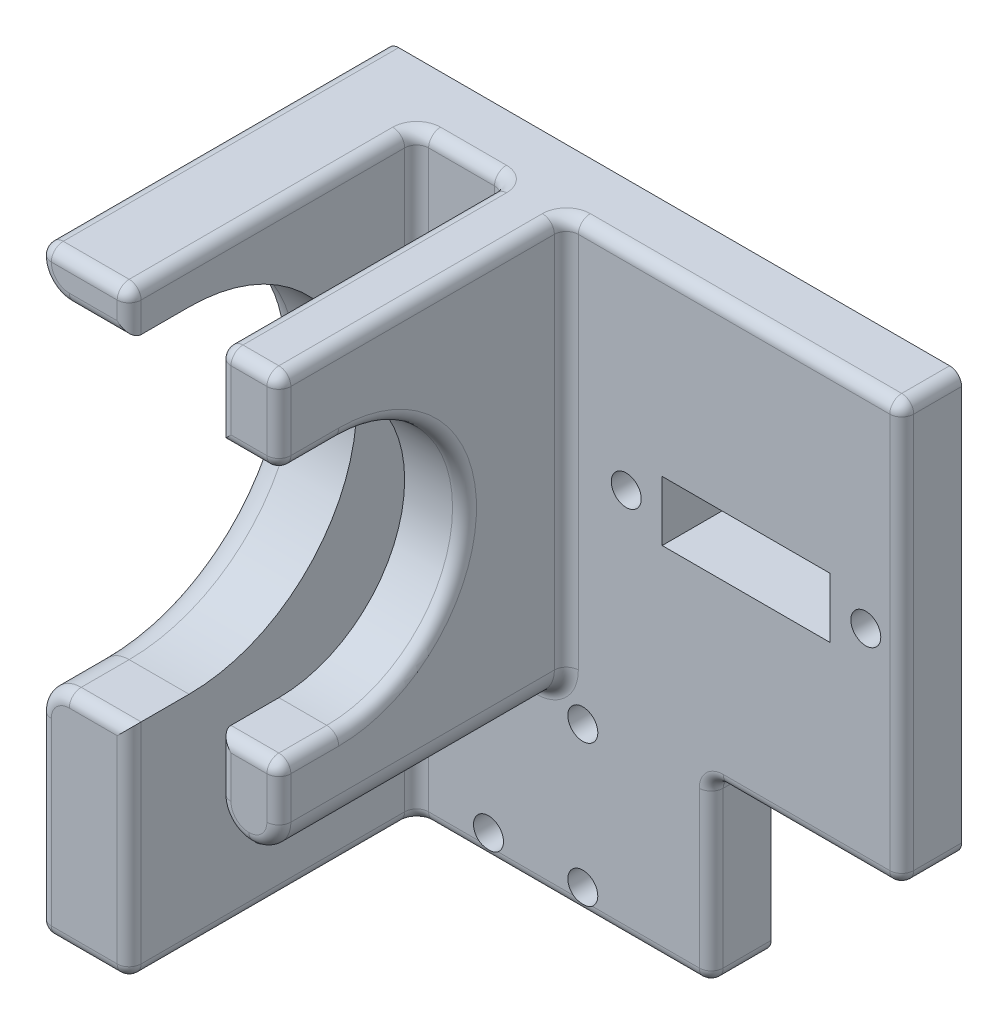
from build123d import *

# Parameters (mm, degrees)
SKETCH1_W           = 60.96
SKETCH1_H           = 44.45
BOSS_EXTRUDE1_DEPTH = 6.35
SKETCH2_W           = 9.525
SKETCH2_H           = 44.45
SKETCH2_W_2         = 6.35
BOSS_EXTRUDE2_DEPTH = 44.45
CUT_EXTRUDE1_DEPTH  = 91.953637091
SKETCH4_R           = 1.5875
CUT_EXTRUDE2_DEPTH  = 44.45
SKETCH6_W           = 17.78
SKETCH6_H           = 6.35
CUT_EXTRUDE3_DEPTH  = 82.369247877
SKETCH7_W           = 9.525
SKETCH7_H           = 36.83
BOSS_EXTRUDE3_DEPTH = 19.05
SKETCH8_R           = 3.048
CUT_EXTRUDE4_DEPTH  = 3.175
SKETCH9_R           = 1.5875
CUT_EXTRUDE5_DEPTH  = 84.954588916
CUT_EXTRUDE6_REACH  = 85.955
SKETCH12_W          = 31.236927456
SKETCH12_H          = 6.35
BOSS_EXTRUDE4_DEPTH = 19.05
FILLET1_R           = 3.175
SKETCH11_R          = 1.5875
CUT_EXTRUDE7_DEPTH  = 84.954588916
FILLET3_R           = 3.175
FILLET4_R           = 1.27


# Some blends are built 0.0001 mm under size
with BuildPart() as part:
    # Sketch1 → Boss-Extrude1 (new body)
    with BuildSketch(Plane.XY):
        with Locations((30.48, 22.225)):
            Rectangle(SKETCH1_W, SKETCH1_H)
    extrude(amount=BOSS_EXTRUDE1_DEPTH)

    # Sketch2 → Boss-Extrude2 (add)
    with BuildSketch(Plane.XY.offset(6.35)):
        with Locations((4.7625, 22.225)):
            Rectangle(SKETCH2_W, SKETCH2_H)
        with Locations((22.225, 22.225)):
            Rectangle(SKETCH2_W_2, SKETCH2_H)
    extrude(amount=BOSS_EXTRUDE2_DEPTH)

    # Sketch3 → Cut-Extrude1 (cut, through all)
    with BuildSketch(Plane.ZY):
        with BuildLine():
            Line((30.48, 35.56), (36.83, 35.56))
            Line((36.83, 35.56), (36.83, 44.45))
            Line((36.83, 44.45), (50.8, 44.45))
            Line((50.8, 44.45), (50.8, 0))
            Line((50.8, 0), (36.83, 0))
            Line((36.83, 0), (36.83, 8.89))
            Line((36.83, 8.89), (30.48, 8.89))
            ThreePointArc((30.48, 8.89), (17.145, 22.225), (30.48, 35.56))
        make_face()
    extrude(amount=-CUT_EXTRUDE1_DEPTH, mode=Mode.SUBTRACT)

    # Sketch4 → Cut-Extrude2 (cut)
    with BuildSketch(Plane.XY.offset(6.35)):
        with Locations((57.15, 22.225)):
            Circle(SKETCH4_R)
        with Locations((31.75, 22.225)):
            Circle(SKETCH4_R)
    extrude(amount=-CUT_EXTRUDE2_DEPTH, mode=Mode.SUBTRACT)

    # Sketch6 → Cut-Extrude3 (cut, through all)
    with BuildSketch(Plane.XY.offset(6.35)):
        with Locations((44.45, 22.225)):
            Rectangle(SKETCH6_W, SKETCH6_H)
    extrude(amount=-CUT_EXTRUDE3_DEPTH, mode=Mode.SUBTRACT)

    # Sketch7 → Boss-Extrude3 (add)
    with BuildSketch(Plane.XZ):
        with Locations((4.7625, 18.415)):
            Rectangle(SKETCH7_W, SKETCH7_H)
    extrude(amount=BOSS_EXTRUDE3_DEPTH)

    # Sketch8 → Cut-Extrude4 (cut)
    with BuildSketch(Plane.ZY):
        with Locations((22.1996, -11.6586)):
            Circle(SKETCH8_R)
    extrude(amount=-CUT_EXTRUDE4_DEPTH, mode=Mode.SUBTRACT)

    # Sketch9 → Cut-Extrude5 (cut, through all)
    with BuildSketch(Plane.ZY):
        with Locations((22.1996, -11.6586)):
            Circle(SKETCH9_R)
    extrude(amount=-CUT_EXTRUDE5_DEPTH, mode=Mode.SUBTRACT)

    # Sketch10 → Cut-Extrude6 (cut, up to next)
    with BuildSketch(Plane.ZY, mode=Mode.PRIVATE) as cut_extrude6_sk1:
        with BuildLine():
            Line((30.48, 4.445), (36.83, 4.445))
            Line((36.83, 4.445), (36.83, 40.005))
            Line((36.83, 40.005), (30.48, 40.005))
            ThreePointArc((30.48, 40.005), (12.7, 22.225), (30.48, 4.445))
        make_face()
    cut_extrude6_tool1 = extrude(cut_extrude6_sk1.sketch, amount=-CUT_EXTRUDE6_REACH, mode=Mode.PRIVATE) & part.part
    add(cut_extrude6_tool1.solids().sort_by_distance((0, 22.225, 26.285194))[0], mode=Mode.SUBTRACT)

    # Sketch12 → Boss-Extrude4 (add)
    with BuildSketch(Plane.XZ):
        with Locations((25.143463728, 3.175)):
            Rectangle(SKETCH12_W, SKETCH12_H)
    extrude(amount=BOSS_EXTRUDE4_DEPTH)

    # Fillet1
    fillet1_edges = [part.edges().sort_by_distance(p)[0] for p in [
        (0, 40.005, 33.655),
        (0, 22.225, 12.7),
        (0, 4.445, 33.655),
    ]]
    fillet(fillet1_edges, radius=FILLET1_R)

    # Sketch11 → Cut-Extrude7 (cut, through all)
    with BuildSketch(Plane(origin=(0, 0, 0), x_dir=(-1, 0, 0), z_dir=(0, 0, -1))):
        with Locations((-27.145, -16.55)):
            Circle(SKETCH11_R)
        with Locations((-17.145, -16.55)):
            Circle(SKETCH11_R)
        with Locations((-17.145, -1.55)):
            Circle(SKETCH11_R)
        with Locations((-27.145, -1.55)):
            Circle(SKETCH11_R)
    extrude(amount=-CUT_EXTRUDE7_DEPTH, mode=Mode.SUBTRACT)

    # Fillet3
    fillet3_edges = [part.edges().sort_by_distance(p)[0] for p in [
        (19.05, 0, 21.59),
        (25.4, 0, 21.59),
    ]]
    fillet(fillet3_edges, radius=FILLET3_R - 0.0001)  # a hair under: the kernel refuses the full size

    # Fillet4
    # the kernel refuses this fillet: 1.27 mm, written as the material it adds along each edge
    with BuildSketch(Plane(origin=(19.05, 44.45, 6.35), x_dir=(-1, 0, 0), z_dir=(0, -1, 0)), Plane(origin=(25.4, 3.1749, 6.35), x_dir=(1, 0, 0), z_dir=(0, 1, 0))) as fillet4_piece_1:
        with BuildLine():
            CenterArc((FILLET4_R, -FILLET4_R), FILLET4_R, 90, 90)
            Line((0, -FILLET4_R), (0, 0))
            Line((0, 0), (FILLET4_R, 0))
        make_face()
    extrude(amount=41.2751)
    with BuildSketch(Plane(origin=(22.2249, 3.1749, 6.35), x_dir=(-1, 0, 0), z_dir=(0, 1, 0))) as fillet4_piece_2:
        with BuildLine():
            CenterArc((3.1749 + FILLET4_R, FILLET4_R), FILLET4_R, 180, 90)
            Line((3.1749, FILLET4_R), (3.1749, 0))
            Line((3.1749, 0), (3.1749 + FILLET4_R, 0))
        make_face()
    revolve(axis=Axis((22.2249, 3.1749, 6.35), (0, 0, 1)), revolution_arc=90)
    with BuildSketch(Plane(origin=(22.2251, 3.1749, 6.35), x_dir=(1, 0, 0), z_dir=(0, 1, 0))) as fillet4_piece_3:
        with BuildLine():
            CenterArc((3.1749 + FILLET4_R, -FILLET4_R), FILLET4_R, 90, 90)
            Line((3.1749, -FILLET4_R), (3.1749, 0))
            Line((3.1749, 0), (3.1749 + FILLET4_R, 0))
        make_face()
    revolve(axis=Axis((22.2251, 3.1749, 6.35), (0, 0, -1)), revolution_arc=90)
    with BuildSketch(Plane(origin=(40.761927456, 0, 6.35), x_dir=(1, 0, 0), z_dir=(0, 0, -1))) as fillet4_piece_4:
        with BuildLine():
            CenterArc((FILLET4_R, FILLET4_R), FILLET4_R, 180, 90)
            Line((0, FILLET4_R), (0, 0))
            Line((0, 0), (FILLET4_R, 0))
        make_face()
    extrude(amount=6.35)
    with BuildSketch(Plane(origin=(9.525, 44.45, 6.35), x_dir=(1, 0, 0), z_dir=(0, -1, 0))) as fillet4_piece_5:
        with BuildLine():
            CenterArc((FILLET4_R, FILLET4_R), FILLET4_R, 180, 90)
            Line((0, FILLET4_R), (0, 0))
            Line((0, 0), (FILLET4_R, 0))
        make_face()
    extrude(amount=63.5)
    with BuildSketch(Plane(origin=(22.2249, 0, 6.35), x_dir=(0, -1, 0), z_dir=(1, 0, 0))) as fillet4_piece_6:
        with BuildLine():
            CenterArc((FILLET4_R, -FILLET4_R), FILLET4_R, 90, 90)
            Line((0, -FILLET4_R), (0, 0))
            Line((0, 0), (FILLET4_R, 0))
        make_face()
    extrude(amount=0.0002)
    # the kernel refuses this fillet: 1.27 mm, written as the material it takes off along each edge
    with BuildSketch(Plane(origin=(24.13, 36.83, 35.56), x_dir=(0, 0, 1), z_dir=(0, -1, 0))) as fillet4_2_piece_1_section:
        Polygon((0, 0), (FILLET4_R, 0), (FILLET4_R, -FILLET4_R), (0, -FILLET4_R), align=None)
    fillet4_2_piece_1 = extrude(amount=FILLET4_R, mode=Mode.PRIVATE)
    fillet4_2_piece_1 = fillet4_2_piece_1 - Plane(origin=(24.13, 36.83, 35.56), x_dir=(-0.7071067811865475, 0, -0.7071067811865475), z_dir=(0, -1, 0)) * Sphere(FILLET4_R, mode=Mode.PRIVATE)
    add(fillet4_2_piece_1, mode=Mode.SUBTRACT)
    with BuildSketch(Plane(origin=(24.13, 7.62, 35.56), x_dir=(0, 0, 1), z_dir=(0, 1, 0))) as fillet4_2_piece_2_section:
        Polygon((0, 0), (FILLET4_R, 0), (FILLET4_R, FILLET4_R), (0, FILLET4_R), align=None)
    fillet4_2_piece_2 = extrude(amount=FILLET4_R, mode=Mode.PRIVATE)
    fillet4_2_piece_2 = fillet4_2_piece_2 - Plane(origin=(24.13, 7.62, 35.56), x_dir=(-0.7071067811865475, 0, -0.7071067811865475), z_dir=(0, 1, 0)) * Sphere(FILLET4_R, mode=Mode.PRIVATE)
    add(fillet4_2_piece_2, mode=Mode.SUBTRACT)
    with BuildSketch(Plane(origin=(1.27, 43.18, 35.56), x_dir=(0, 0, 1), z_dir=(-1, 0, 0))) as fillet4_2_piece_3_section:
        Polygon((0, 0), (FILLET4_R, 0), (FILLET4_R, FILLET4_R), (0, FILLET4_R), align=None)
    fillet4_2_piece_3 = extrude(amount=FILLET4_R, mode=Mode.PRIVATE)
    fillet4_2_piece_3 = fillet4_2_piece_3 - Plane(origin=(1.27, 43.18, 35.56), x_dir=(0, -0.7071067811865479, -0.7071067811865472), z_dir=(-1, 0, 0)) * Sphere(FILLET4_R, mode=Mode.PRIVATE)
    add(fillet4_2_piece_3, mode=Mode.SUBTRACT)
    with BuildSketch(Plane(origin=(1.27, -17.78, 35.56), x_dir=(0, 0, 1), z_dir=(-1, 0, 0))) as fillet4_2_piece_4_section:
        Polygon((0, 0), (FILLET4_R, 0), (FILLET4_R, -FILLET4_R), (0, -FILLET4_R), align=None)
    fillet4_2_piece_4 = extrude(amount=FILLET4_R, mode=Mode.PRIVATE)
    fillet4_2_piece_4 = fillet4_2_piece_4 - Plane(origin=(1.27, -17.78, 35.56), x_dir=(0, 0.7071067811865475, -0.7071067811865475), z_dir=(-1, 0, 0)) * Sphere(FILLET4_R, mode=Mode.PRIVATE)
    add(fillet4_2_piece_4, mode=Mode.SUBTRACT)
    with BuildSketch(Plane(origin=(19.05, 12.065, 36.83), x_dir=(0, 0, -1), z_dir=(0, -1, 0))) as fillet4_2_piece_5:
        with BuildLine():
            CenterArc((FILLET4_R, FILLET4_R), FILLET4_R, 180, 90)
            Line((0, FILLET4_R), (0, 0))
            Line((0, 0), (FILLET4_R, 0))
        make_face()
    extrude(amount=8.8901, mode=Mode.SUBTRACT)
    with BuildSketch(Plane(origin=(22.2249, 3.1749, 36.83), x_dir=(-1, 0, 0), z_dir=(0, 1, 0))) as fillet4_2_piece_6:
        with BuildLine():
            CenterArc((3.1749 - FILLET4_R, -FILLET4_R), FILLET4_R, 0, 90)
            Line((3.1749 - FILLET4_R, 0), (3.1749, 0))
            Line((3.1749, 0), (3.1749, -FILLET4_R))
        make_face()
    revolve(axis=Axis((22.2249, 3.1749, 36.83), (0, 0, 1)), revolution_arc=90, mode=Mode.SUBTRACT)
    with BuildSketch(Plane(origin=(22.2251, 3.1749, 36.83), x_dir=(1, 0, 0), z_dir=(0, 1, 0))) as fillet4_2_piece_7:
        with BuildLine():
            CenterArc((3.1749 - FILLET4_R, FILLET4_R), FILLET4_R, 270, 90)
            Line((3.1749 - FILLET4_R, 0), (3.1749, 0))
            Line((3.1749, 0), (3.1749, FILLET4_R))
        make_face()
    revolve(axis=Axis((22.2251, 3.1749, 36.83), (0, 0, -1)), revolution_arc=90, mode=Mode.SUBTRACT)
    with BuildSketch(Plane(origin=(25.4, 35.56, 30.48), x_dir=(0, 1, 0), z_dir=(0, 0, 1)), Plane(origin=(25.4, 8.89, 35.56), x_dir=(0, -1, 0), z_dir=(0, 0, -1))) as fillet4_2_piece_8:
        with BuildLine():
            CenterArc((FILLET4_R, FILLET4_R), FILLET4_R, 180, 90)
            Line((0, FILLET4_R), (0, 0))
            Line((0, 0), (FILLET4_R, 0))
        make_face()
    extrude(amount=5.08, mode=Mode.SUBTRACT)
    with BuildSketch(Plane(origin=(3.175, 40.005, 36.83), x_dir=(0, 1, 0), z_dir=(1, 0, 0))) as fillet4_2_piece_9:
        with BuildLine():
            CenterArc((FILLET4_R, -FILLET4_R), FILLET4_R, 90, 90)
            Line((0, -FILLET4_R), (0, 0))
            Line((0, 0), (FILLET4_R, 0))
        make_face()
    extrude(amount=9.525, mode=Mode.SUBTRACT)
    with BuildSketch(Plane(origin=(3.175, 43.18, 36.83), x_dir=(-1, 0, 0), z_dir=(0, 1, 0))) as fillet4_2_piece_10:
        with BuildLine():
            CenterArc((3.175 - FILLET4_R, -FILLET4_R), FILLET4_R, 0, 90)
            Line((3.175, -FILLET4_R), (3.175, 0))
            Line((3.175, 0), (3.175 - FILLET4_R, 0))
        make_face()
    revolve(axis=Axis((3.175, 43.18, 36.83), (0, 0, 1)), revolution_arc=90, mode=Mode.SUBTRACT)
    with BuildSketch(Plane(origin=(3.175, 4.445, 36.83), x_dir=(0, -1, 0), z_dir=(1, 0, 0))) as fillet4_2_piece_11:
        with BuildLine():
            CenterArc((FILLET4_R, FILLET4_R), FILLET4_R, 180, 90)
            Line((0, FILLET4_R), (0, 0))
            Line((0, 0), (FILLET4_R, 0))
        make_face()
    extrude(amount=9.525, mode=Mode.SUBTRACT)
    with BuildSketch(Plane(origin=(3.175, 1.27, 36.83), x_dir=(-1, 0, 0), z_dir=(0, -1, 0))) as fillet4_2_piece_12:
        with BuildLine():
            CenterArc((3.175 - FILLET4_R, FILLET4_R), FILLET4_R, 270, 90)
            Line((3.175, FILLET4_R), (3.175, 0))
            Line((3.175, 0), (3.175 - FILLET4_R, 0))
        make_face()
    revolve(axis=Axis((3.175, 1.27, 36.83), (0, 0, -1)), revolution_arc=90, mode=Mode.SUBTRACT)
    with BuildSketch(Plane(origin=(15.875, 8.89, 36.83), x_dir=(0, 0, -1), z_dir=(1, 0, 0)), Plane(origin=(15.875, 35.56, 36.83), x_dir=(0, 1, 0), z_dir=(1, 0, 0))) as fillet4_2_piece_13:
        with BuildLine():
            CenterArc((FILLET4_R, -FILLET4_R), FILLET4_R, 90, 90)
            Line((0, -FILLET4_R), (0, 0))
            Line((0, 0), (FILLET4_R, 0))
        make_face()
    extrude(amount=8.255, mode=Mode.SUBTRACT)
    with BuildSketch(Plane(origin=(40.761927456, -19.05, 9.525), x_dir=(0, 1, 0), z_dir=(0, 0, -1)), Plane(origin=(15.875, 44.45, 36.83), x_dir=(0, 0, -1), z_dir=(1, 0, 0))) as fillet4_2_piece_14:
        with BuildLine():
            CenterArc((FILLET4_R, -FILLET4_R), FILLET4_R, 90, 90)
            Line((0, -FILLET4_R), (0, 0))
            Line((0, 0), (FILLET4_R, 0))
        make_face()
    extrude(amount=12.7, mode=Mode.SUBTRACT)
    with BuildSketch(Plane(origin=(60.96, 0, -3.175), x_dir=(0, 1, 0), z_dir=(0, 0, 1)), Plane(origin=(60.96, 44.45, -3.175), x_dir=(-1, 0, 0), z_dir=(0, 0, 1))) as fillet4_2_piece_15:
        with BuildLine():
            CenterArc((FILLET4_R, FILLET4_R), FILLET4_R, 180, 90)
            Line((0, FILLET4_R), (0, 0))
            Line((0, 0), (FILLET4_R, 0))
        make_face()
    extrude(amount=12.7, mode=Mode.SUBTRACT)
    with BuildSketch(Plane(origin=(9.525, 36.83, 36.83), x_dir=(-1, 0, 0), z_dir=(0, 1, 0))) as fillet4_2_piece_16:
        with BuildLine():
            CenterArc((FILLET4_R, -FILLET4_R), FILLET4_R, 90, 90)
            Line((0, -FILLET4_R), (0, 0))
            Line((0, 0), (FILLET4_R, 0))
        make_face()
    extrude(amount=10.795, mode=Mode.SUBTRACT)
    with BuildSketch(Plane(origin=(9.525, 7.62, 36.83), x_dir=(0, 0, -1), z_dir=(0, -1, 0))) as fillet4_2_piece_17:
        with BuildLine():
            CenterArc((FILLET4_R, -FILLET4_R), FILLET4_R, 90, 90)
            Line((0, -FILLET4_R), (0, 0))
            Line((0, 0), (FILLET4_R, 0))
        make_face()
    extrude(amount=29.845, mode=Mode.SUBTRACT)
    with BuildSketch(Plane(origin=(25.4, 3.1749, 36.83), x_dir=(0, 0, -1), z_dir=(0, 1, 0))) as fillet4_2_piece_18:
        with BuildLine():
            CenterArc((FILLET4_R, FILLET4_R), FILLET4_R, 180, 90)
            Line((0, FILLET4_R), (0, 0))
            Line((0, 0), (FILLET4_R, 0))
        make_face()
    extrude(amount=4.4451, mode=Mode.SUBTRACT)
    with BuildSketch(Plane(origin=(25.4, 22.225, 30.48), x_dir=(0, 1, 0), z_dir=(0, 0, 1))) as fillet4_2_piece_19:
        with BuildLine():
            CenterArc((13.335 + FILLET4_R, FILLET4_R), FILLET4_R, 180, 90)
            Line((13.335, FILLET4_R), (13.335, 0))
            Line((13.335, 0), (13.335 + FILLET4_R, 0))
        make_face()
    revolve(axis=Axis((25.4, 22.225, 30.48), (-1, 0, 0)), revolution_arc=180, mode=Mode.SUBTRACT)
    with BuildSketch(Plane(origin=(19.05, 47.625, 36.83), x_dir=(0, 0, -1), z_dir=(0, -1, 0))) as fillet4_2_piece_20:
        with BuildLine():
            CenterArc((FILLET4_R, FILLET4_R), FILLET4_R, 180, 90)
            Line((0, FILLET4_R), (0, 0))
            Line((0, 0), (FILLET4_R, 0))
        make_face()
    extrude(amount=15.24, mode=Mode.SUBTRACT)
    with BuildSketch(Plane(origin=(25.4, 36.83, 36.83), x_dir=(0, 0, -1), z_dir=(0, 1, 0))) as fillet4_2_piece_21:
        with BuildLine():
            CenterArc((FILLET4_R, FILLET4_R), FILLET4_R, 180, 90)
            Line((0, FILLET4_R), (0, 0))
            Line((0, 0), (FILLET4_R, 0))
        make_face()
    extrude(amount=10.795, mode=Mode.SUBTRACT)
    with BuildSketch(Plane(origin=(0, 44.45, 35.56), x_dir=(1, 0, 0), z_dir=(0, 0, -1)), Plane(origin=(0, -19.05, -3.175), x_dir=(1, 0, 0), z_dir=(0, 0, 1))) as fillet4_2_piece_22:
        with BuildLine():
            CenterArc((FILLET4_R, FILLET4_R), FILLET4_R, 180, 90)
            Line((0, FILLET4_R), (0, 0))
            Line((0, 0), (FILLET4_R, 0))
        make_face()
    extrude(amount=38.735, mode=Mode.SUBTRACT)
    with BuildSketch(Plane(origin=(1.27, 44.45, 36.83), x_dir=(0, 0, -1), z_dir=(1, 0, 0))) as fillet4_2_piece_23:
        with BuildLine():
            CenterArc((FILLET4_R, -FILLET4_R), FILLET4_R, 90, 90)
            Line((0, -FILLET4_R), (0, 0))
            Line((0, 0), (FILLET4_R, 0))
        make_face()
    extrude(amount=11.43, mode=Mode.SUBTRACT)
    with BuildSketch(Plane(origin=(0, -17.78, 36.83), x_dir=(0, 0, -1), z_dir=(0, 1, 0))) as fillet4_2_piece_24:
        with BuildLine():
            CenterArc((FILLET4_R, -FILLET4_R), FILLET4_R, 90, 90)
            Line((0, -FILLET4_R), (0, 0))
            Line((0, 0), (FILLET4_R, 0))
        make_face()
    extrude(amount=19.05, mode=Mode.SUBTRACT)
    with BuildSketch(Plane(origin=(1.27, -19.05, 36.83), x_dir=(0, 0, -1), z_dir=(1, 0, 0))) as fillet4_2_piece_25:
        with BuildLine():
            CenterArc((FILLET4_R, FILLET4_R), FILLET4_R, 180, 90)
            Line((0, FILLET4_R), (0, 0))
            Line((0, 0), (FILLET4_R, 0))
        make_face()
    extrude(amount=11.43, mode=Mode.SUBTRACT)
    with BuildSketch(Plane(origin=(60.96, -3.175, 6.35), x_dir=(-1, 0, 0), z_dir=(0, 1, 0))) as fillet4_2_piece_26:
        with BuildLine():
            CenterArc((FILLET4_R, -FILLET4_R), FILLET4_R, 90, 90)
            Line((0, -FILLET4_R), (0, 0))
            Line((0, 0), (FILLET4_R, 0))
        make_face()
    extrude(amount=50.8, mode=Mode.SUBTRACT)
    with BuildSketch(Plane(origin=(22.2249, 0, 36.83), x_dir=(0, 0, -1), z_dir=(1, 0, 0))) as fillet4_2_piece_27:
        with BuildLine():
            CenterArc((FILLET4_R, FILLET4_R), FILLET4_R, 180, 90)
            Line((0, FILLET4_R), (0, 0))
            Line((0, 0), (FILLET4_R, 0))
        make_face()
    extrude(amount=0.0002, mode=Mode.SUBTRACT)
    # the kernel refuses this fillet: 1.27 mm, written as the material it takes off along each edge
    with BuildSketch(Plane(origin=(59.69, 1.27, 5.08), x_dir=(0, -1, 0), z_dir=(0, 0, 1))) as fillet4_3_piece_1_section:
        Polygon((0, 0), (FILLET4_R, 0), (FILLET4_R, FILLET4_R), (0, FILLET4_R), align=None)
    fillet4_3_piece_1 = extrude(amount=FILLET4_R, mode=Mode.PRIVATE)
    fillet4_3_piece_1 = fillet4_3_piece_1 - Plane(origin=(59.69, 1.27, 5.08), x_dir=(-0.7071067811865475, 0.7071067811865475, 0), z_dir=(0, 0, 1)) * Sphere(FILLET4_R, mode=Mode.PRIVATE)
    add(fillet4_3_piece_1, mode=Mode.SUBTRACT)
    with BuildSketch(Plane(origin=(59.69, 43.18, 5.08), x_dir=(0, 1, 0), z_dir=(0, 0, 1))) as fillet4_3_piece_2_section:
        Polygon((0, 0), (FILLET4_R, 0), (FILLET4_R, -FILLET4_R), (0, -FILLET4_R), align=None)
    fillet4_3_piece_2 = extrude(amount=FILLET4_R, mode=Mode.PRIVATE)
    fillet4_3_piece_2 = fillet4_3_piece_2 - Plane(origin=(59.69, 43.18, 5.08), x_dir=(-0.7071067811865475, -0.7071067811865475, 0), z_dir=(0, 0, 1)) * Sphere(FILLET4_R, mode=Mode.PRIVATE)
    add(fillet4_3_piece_2, mode=Mode.SUBTRACT)
    with BuildSketch(Plane(origin=(8.255, -17.78, 35.56), x_dir=(1, 0, 0), z_dir=(0, -1, 0))) as fillet4_3_piece_3_section:
        Polygon((0, 0), (FILLET4_R, 0), (FILLET4_R, FILLET4_R), (0, FILLET4_R), align=None)
    fillet4_3_piece_3 = extrude(amount=FILLET4_R, mode=Mode.PRIVATE)
    fillet4_3_piece_3 = fillet4_3_piece_3 - Plane(origin=(8.255, -17.78, 35.56), x_dir=(-0.7071067811865475, 0, -0.7071067811865477), z_dir=(0, -1, 0)) * Sphere(FILLET4_R, mode=Mode.PRIVATE)
    add(fillet4_3_piece_3, mode=Mode.SUBTRACT)
    with BuildSketch(Plane(origin=(24.13, 43.18, 35.56), x_dir=(1, 0, 0), z_dir=(0, 1, 0))) as fillet4_3_piece_4_section:
        Polygon((0, 0), (FILLET4_R, 0), (FILLET4_R, -FILLET4_R), (0, -FILLET4_R), align=None)
    fillet4_3_piece_4 = extrude(amount=FILLET4_R, mode=Mode.PRIVATE)
    fillet4_3_piece_4 = fillet4_3_piece_4 - Plane(origin=(24.13, 43.18, 35.56), x_dir=(-0.7071067811865475, 0, -0.7071067811865475), z_dir=(0, 1, 0)) * Sphere(FILLET4_R, mode=Mode.PRIVATE)
    add(fillet4_3_piece_4, mode=Mode.SUBTRACT)
    with BuildSketch(Plane(origin=(20.32, 43.18, 35.56), x_dir=(-1, 0, 0), z_dir=(0, 1, 0))) as fillet4_3_piece_5_section:
        Polygon((0, 0), (FILLET4_R, 0), (FILLET4_R, FILLET4_R), (0, FILLET4_R), align=None)
    fillet4_3_piece_5 = extrude(amount=FILLET4_R, mode=Mode.PRIVATE)
    fillet4_3_piece_5 = fillet4_3_piece_5 - Plane(origin=(20.32, 43.18, 35.56), x_dir=(0.7071067811865475, 0, -0.7071067811865475), z_dir=(0, 1, 0)) * Sphere(FILLET4_R, mode=Mode.PRIVATE)
    add(fillet4_3_piece_5, mode=Mode.SUBTRACT)
    with BuildSketch(Plane(origin=(8.255, 43.18, 35.56), x_dir=(1, 0, 0), z_dir=(0, 1, 0))) as fillet4_3_piece_6_section:
        Polygon((0, 0), (FILLET4_R, 0), (FILLET4_R, -FILLET4_R), (0, -FILLET4_R), align=None)
    fillet4_3_piece_6 = extrude(amount=FILLET4_R, mode=Mode.PRIVATE)
    fillet4_3_piece_6 = fillet4_3_piece_6 - Plane(origin=(8.255, 43.18, 35.56), x_dir=(-0.7071067811865475, 0, -0.7071067811865477), z_dir=(0, 1, 0)) * Sphere(FILLET4_R, mode=Mode.PRIVATE)
    add(fillet4_3_piece_6, mode=Mode.SUBTRACT)
    with BuildSketch(Plane(origin=(9.525, 44.45, 7.62), x_dir=(-1, 0, 0), z_dir=(0, 0, 1)), Plane(origin=(25.4, 44.45, 7.62), x_dir=(-1, 0, 0), z_dir=(0, 0, 1)), Plane(origin=(9.525, -19.05, 35.56), x_dir=(-1, 0, 0), z_dir=(0, 0, -1))) as fillet4_3_piece_7:
        with BuildLine():
            CenterArc((FILLET4_R, FILLET4_R), FILLET4_R, 180, 90)
            Line((0, FILLET4_R), (0, 0))
            Line((0, 0), (FILLET4_R, 0))
        make_face()
    extrude(amount=27.94, mode=Mode.SUBTRACT)
    with BuildSketch(Plane(origin=(19.05, 44.45, 7.62), x_dir=(1, 0, 0), z_dir=(0, 0, 1))) as fillet4_3_piece_8:
        with BuildLine():
            CenterArc((FILLET4_R, -FILLET4_R), FILLET4_R, 90, 90)
            Line((0, -FILLET4_R), (0, 0))
            Line((0, 0), (FILLET4_R, 0))
        make_face()
    extrude(amount=27.94, mode=Mode.SUBTRACT)
    with BuildSketch(Plane(origin=(10.795, -19.05, 6.35), x_dir=(0, 1, 0), z_dir=(1, 0, 0))) as fillet4_3_piece_9:
        with BuildLine():
            CenterArc((FILLET4_R, -FILLET4_R), FILLET4_R, 90, 90)
            Line((0, -FILLET4_R), (0, 0))
            Line((0, 0), (FILLET4_R, 0))
        make_face()
    extrude(amount=28.696927456, mode=Mode.SUBTRACT)
    with BuildSketch(Plane(origin=(17.78, 44.45, 6.35), x_dir=(0, -1, 0), z_dir=(-1, 0, 0))) as fillet4_3_piece_10:
        with BuildLine():
            CenterArc((FILLET4_R, -FILLET4_R), FILLET4_R, 90, 90)
            Line((0, -FILLET4_R), (0, 0))
            Line((0, 0), (FILLET4_R, 0))
        make_face()
    extrude(amount=6.985, mode=Mode.SUBTRACT)
    with BuildSketch(Plane(origin=(59.69, 44.45, 6.35), x_dir=(0, -1, 0), z_dir=(-1, 0, 0))) as fillet4_3_piece_11:
        with BuildLine():
            CenterArc((FILLET4_R, -FILLET4_R), FILLET4_R, 90, 90)
            Line((0, -FILLET4_R), (0, 0))
            Line((0, 0), (FILLET4_R, 0))
        make_face()
    extrude(amount=33.02, mode=Mode.SUBTRACT)
    with BuildSketch(Plane(origin=(42.031927456, 0, 6.35), x_dir=(0, 1, 0), z_dir=(1, 0, 0))) as fillet4_3_piece_12:
        with BuildLine():
            CenterArc((FILLET4_R, -FILLET4_R), FILLET4_R, 90, 90)
            Line((0, -FILLET4_R), (0, 0))
            Line((0, 0), (FILLET4_R, 0))
        make_face()
    extrude(amount=17.658072544, mode=Mode.SUBTRACT)
    with BuildSketch(Plane(origin=(40.761927456, -1.27, 6.35), x_dir=(-1, 0, 0), z_dir=(0, -1, 0))) as fillet4_3_piece_13:
        with BuildLine():
            CenterArc((FILLET4_R, FILLET4_R), FILLET4_R, 180, 90)
            Line((0, FILLET4_R), (0, 0))
            Line((0, 0), (FILLET4_R, 0))
        make_face()
    extrude(amount=16.51, mode=Mode.SUBTRACT)
    with BuildSketch(Plane(origin=(42.031927456, -1.27, 6.35), x_dir=(0, 1, 0), z_dir=(1, 0, 0))) as fillet4_3_piece_14:
        with BuildLine():
            CenterArc((1.27 + FILLET4_R, -FILLET4_R), FILLET4_R, 90, 90)
            Line((1.27, -FILLET4_R), (1.27, 0))
            Line((1.27, 0), (1.27 + FILLET4_R, 0))
        make_face()
    revolve(axis=Axis((42.031927456, -1.27, 6.35), (0, 0, 1)), revolution_arc=90, mode=Mode.SUBTRACT)
    with BuildSketch(Plane(origin=(39.491927456, -17.78, 6.35), x_dir=(0, -1, 0), z_dir=(-1, 0, 0))) as fillet4_3_piece_15:
        with BuildLine():
            CenterArc((1.27 - FILLET4_R, -FILLET4_R), FILLET4_R, 0, 90)
            Line((1.27, -FILLET4_R), (1.27, 0))
            Line((1.27, 0), (1.27 - FILLET4_R, 0))
        make_face()
    revolve(axis=Axis((39.491927456, -17.78, 6.35), (0, 0, 1)), revolution_arc=90, mode=Mode.SUBTRACT)
    with BuildSketch(Plane(origin=(26.67, 44.45, 7.62), x_dir=(0, 0, -1), z_dir=(1, 0, 0))) as fillet4_3_piece_16:
        with BuildLine():
            CenterArc((1.27 + FILLET4_R, -FILLET4_R), FILLET4_R, 90, 90)
            Line((1.27 + FILLET4_R, 0), (1.27, 0))
            Line((1.27, 0), (1.27, -FILLET4_R))
        make_face()
    revolve(axis=Axis((26.67, 44.45, 7.62), (0, 1, 0)), revolution_arc=90, mode=Mode.SUBTRACT)
    with BuildSketch(Plane(origin=(17.78, 44.45, 7.62), x_dir=(0, 0, -1), z_dir=(-1, 0, 0))) as fillet4_3_piece_17:
        with BuildLine():
            CenterArc((1.27 + FILLET4_R, FILLET4_R), FILLET4_R, 180, 90)
            Line((1.27, FILLET4_R), (1.27, 0))
            Line((1.27, 0), (1.27 + FILLET4_R, 0))
        make_face()
    revolve(axis=Axis((17.78, 44.45, 7.62), (0, -1, 0)), revolution_arc=90, mode=Mode.SUBTRACT)
    with BuildSketch(Plane(origin=(10.795, 44.45, 7.62), x_dir=(0, 0, -1), z_dir=(1, 0, 0))) as fillet4_3_piece_18:
        with BuildLine():
            CenterArc((1.27 + FILLET4_R, -FILLET4_R), FILLET4_R, 90, 90)
            Line((1.27, -FILLET4_R), (1.27, 0))
            Line((1.27, 0), (1.27 + FILLET4_R, 0))
        make_face()
    revolve(axis=Axis((10.795, 44.45, 7.62), (0, 1, 0)), revolution_arc=90, mode=Mode.SUBTRACT)
    with BuildSketch(Plane(origin=(10.795, -19.05, 7.62), x_dir=(0, 0, -1), z_dir=(1, 0, 0))) as fillet4_3_piece_19:
        with BuildLine():
            CenterArc((1.27 + FILLET4_R, FILLET4_R), FILLET4_R, 180, 90)
            Line((1.27, FILLET4_R), (1.27, 0))
            Line((1.27, 0), (1.27 + FILLET4_R, 0))
        make_face()
    revolve(axis=Axis((10.795, -19.05, 7.62), (0, 1, 0)), revolution_arc=90, mode=Mode.SUBTRACT)


solid = part.part
